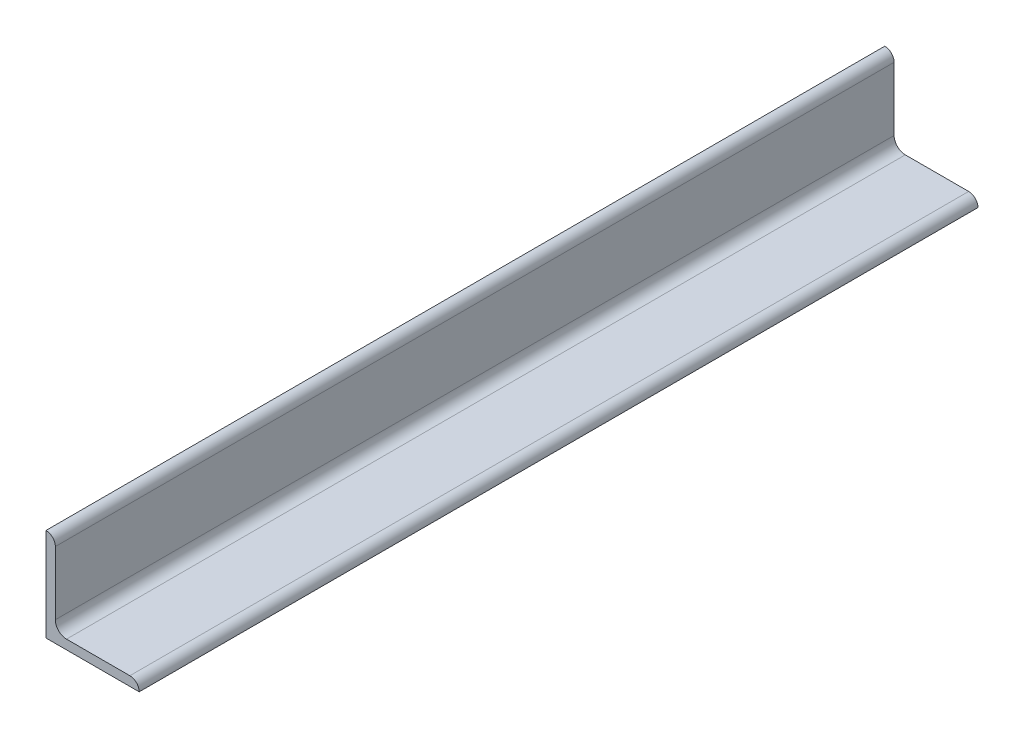
from build123d import *

# Parameters (mm, degrees)
BASESTEELANGLE_DEPTH = 450
TOEFILLET_R          = 10


with BuildPart() as part:
    # Sketch1 → BaseSteelAngle (new, symmetric)
    with BuildSketch(Plane.XY):
        with BuildLine():
            Line((0, 100), (0, 0))
            Line((0, 0), (100, 0))
            Line((100, 0), (100, 10))
            Line((100, 10), (22, 10))
            ThreePointArc((22, 10), (13.514718626, 13.514718626), (10, 22))
            Line((10, 22), (10, 100))
            Line((10, 100), (0, 100))
        make_face()
    extrude(amount=BASESTEELANGLE_DEPTH, both=True)

    # ToeFillet
    toefillet_edges = [part.edges().sort_by_distance(p)[0] for p in [
        (10, 100, 0),
        (100, 10, 0),
    ]]
    fillet(toefillet_edges, radius=TOEFILLET_R - 0.0001)  # a hair under: the kernel refuses the full size


solid = part.part
